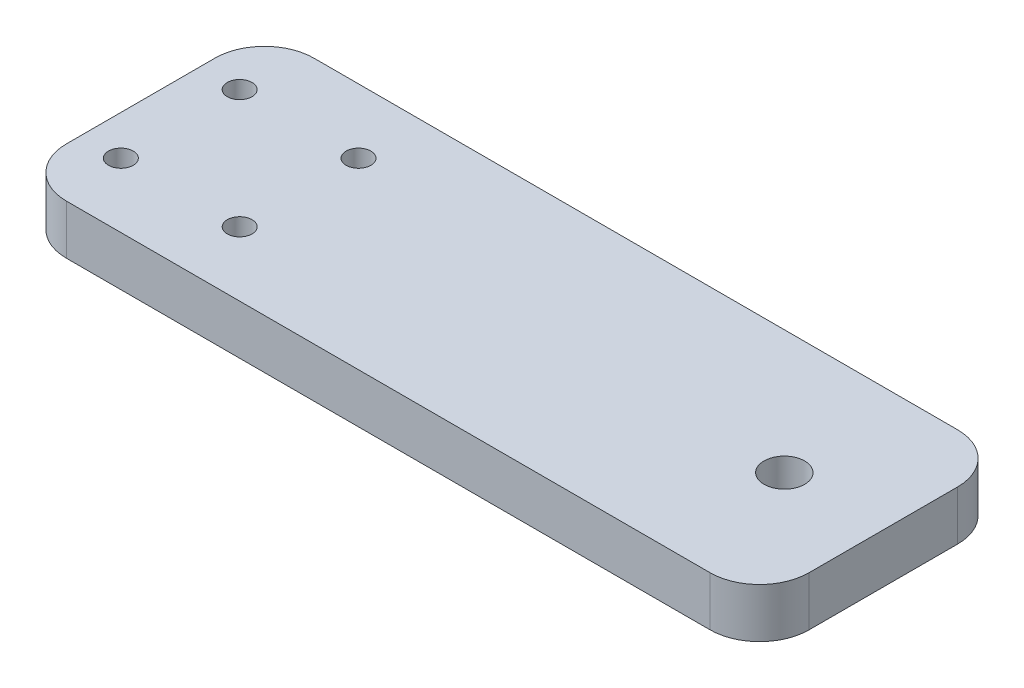
from build123d import *

# Parameters (mm, degrees)
SKETCH_1_W          = 150
SKETCH_1_H          = 50
EXTRUDE_1_DEPTH     = 10
FILLET_1_R          = 10
SKETCH_2_R          = 2.5
SKETCH_2_R_2        = 4.1
CUT_EXTRUDE_1_DEPTH = 80.686887253


with BuildPart() as part:
    # ｽｹｯﾁ1 → ﾎﾞｽ - 押し出し1 (new body)
    with BuildSketch(Plane(origin=(0, 0, 0), x_dir=(1, 0, 0), z_dir=(0, 1, 0))):
        Rectangle(SKETCH_1_W, SKETCH_1_H)
    extrude(amount=EXTRUDE_1_DEPTH)

    # ﾌｨﾚｯﾄ1
    fillet_1_edges = [part.edges().sort_by_distance(p)[0] for p in [
        (-75, 5, -25),
        (75, 5, -25),
        (75, 5, 25),
        (-75, 5, 25),
    ]]
    fillet(fillet_1_edges, radius=FILLET_1_R)

    # ｽｹｯﾁ2 → ｶｯﾄ - 押し出し1 (cut, through all)
    with BuildSketch(Plane(origin=(0, 10, 0), x_dir=(1, 0, 0), z_dir=(0, 1, 0))):
        with Locations((-67, 12)):
            Circle(SKETCH_2_R)
        with Locations((-43, 12)):
            Circle(SKETCH_2_R)
        with Locations((-67, -12)):
            Circle(SKETCH_2_R)
        with Locations((-43, -12)):
            Circle(SKETCH_2_R)
        with Locations((55, 0)):
            Circle(SKETCH_2_R_2)
    extrude(amount=-CUT_EXTRUDE_1_DEPTH, mode=Mode.SUBTRACT)


solid = part.part
